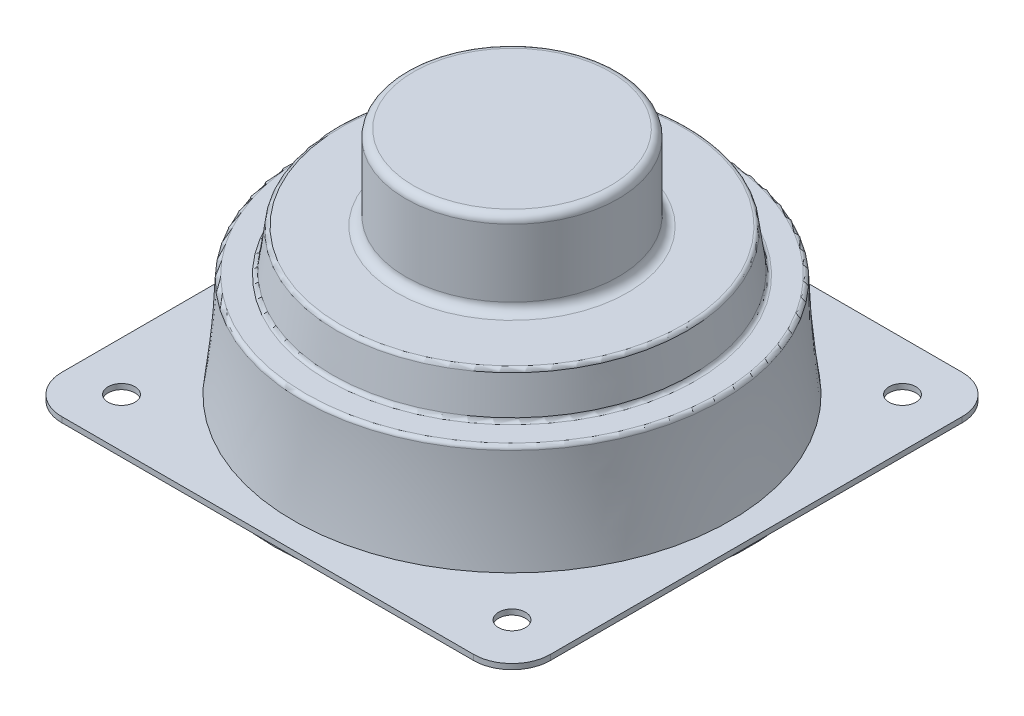
from build123d import *

# Parameters (mm, degrees)
SKETCH1_R           = 1.75
BOSS_EXTRUDE1_DEPTH = 0.7
SKETCH2_R           = 31
BOSS_EXTRUDE2_DEPTH = 1
SKETCH3_R           = 25.2
BOSS_EXTRUDE3_DEPTH = 2
SKETCH6_R           = 23.5
SKETCH7_R           = 22.75
SKETCH8_R           = 13.85
BOSS_EXTRUDE4_DEPTH = 11
FILLET1_R           = 1
FILLET2_R           = 1.2
FILLET3_R           = 0.5


with BuildPart() as part:
    # Sketch1 → Boss-Extrude1 (new body)
    with BuildSketch(Plane(origin=(0, 0, 0), x_dir=(1, 0, 0), z_dir=(0, 1, 0))):
        with BuildLine():
            Line((26.85, -31.85), (-26.85, -31.85))
            ThreePointArc((-26.85, -31.85), (-30.385533906, -30.385533906), (-31.85, -26.85))
            Line((-31.85, -26.85), (-31.85, 26.85))
            ThreePointArc((-31.85, 26.85), (-30.385533906, 30.385533906), (-26.85, 31.85))
            Line((-26.85, 31.85), (26.85, 31.85))
            ThreePointArc((26.85, 31.85), (30.385533906, 30.385533906), (31.85, 26.85))
            Line((31.85, 26.85), (31.85, -26.85))
            ThreePointArc((31.85, -26.85), (30.385533906, -30.385533906), (26.85, -31.85))
        make_face()
        with Locations(Location((-25.455844123, 25.455844123, 0), (0, 0, 270))):
            Circle(SKETCH1_R, mode=Mode.SUBTRACT)
        with Locations(Location((25.455844123, -25.455844123, 0), (0, 0, 270))):
            Circle(SKETCH1_R, mode=Mode.SUBTRACT)
        with Locations(Location((25.455844123, 25.455844123, 0), (0, 0, 270))):
            Circle(SKETCH1_R, mode=Mode.SUBTRACT)
        with Locations(Location((-25.455844123, -25.455844123, 0), (0, 0, 270))):
            Circle(SKETCH1_R, mode=Mode.SUBTRACT)
    extrude(amount=BOSS_EXTRUDE1_DEPTH)

    # Sketch2 → Boss-Extrude2 (add)
    with BuildSketch(Plane.XZ):
        with Locations(Location((0, 0, 0), (0, 0, 270))):
            Circle(SKETCH2_R)
    extrude(amount=BOSS_EXTRUDE2_DEPTH)

    # Sketch3 → Boss-Extrude3 (add)
    with BuildSketch(Plane.XZ.offset(1)):
        with Locations(Location((0, 0, 0), (0, 0, 270))):
            Circle(SKETCH3_R)
    extrude(amount=BOSS_EXTRUDE3_DEPTH)

    # Loft1: read off the stored shape, not the designer's step
    # Loft1: loft between two sections, ruled curve by curve
    loft1_from = [
        Edge.make_bspline([(-9.771875949, 0.7, 26.772382046), (43.772888144, 0.7, 46.316133945), (63.316640042, 0.7, -7.228630148), (9.771875949, 0.7, -26.772382046), (-43.772888144, 0.7, -46.316133945), (-63.316640042, 0.7, 7.228630148), (-9.771875949, 0.7, 26.772382046)], [0, 0, 0, 0, 0.5, 0.5, 0.5, 1, 1, 1, 1], 3, [1, 0.333333333, 0.333333333, 1, 0.333333333, 0.333333333, 1]),
    ]
    loft1_to = [
        Edge.make_bspline([(-3.103696241, 14.2, 27.173324597), (51.242952952, 14.2, 33.380717079), (57.450345435, 14.2, -20.965932114), (3.103696241, 14.2, -27.173324597), (-51.242952952, 14.2, -33.380717079), (-57.450345435, 14.2, 20.965932114), (-3.103696241, 14.2, 27.173324597)], [0, 0, 0, 0, 0.5, 0.5, 0.5, 1, 1, 1, 1], 3, [1, 0.333333333, 0.333333333, 1, 0.333333333, 0.333333333, 1]),
    ]
    loft1 = Solid(Shell([*[Face.make_surface_from_curves(loft1_from[k], loft1_to[k]) for k in range(1)], Face(Wire(loft1_from)), Face(Wire(loft1_to))]))
    add(loft1)

    # Sketch6 → Loft2 section 0
    with BuildSketch(Plane(origin=(0, 14.2, 0), x_dir=(1, 0, 0), z_dir=(0, 1, 0))):
        Circle(SKETCH6_R)
    # Sketch7 → Loft2 section 1
    with BuildSketch(Plane(origin=(0, 19.7, 0), x_dir=(1, 0, 0), z_dir=(0, 1, 0))):
        Circle(SKETCH7_R)
    loft()

    # Sketch8 → Boss-Extrude4 (add)
    with BuildSketch(Plane(origin=(0, 19.7, 0), x_dir=(1, 0, 0), z_dir=(0, 1, 0))):
        with Locations(Location((0, 0, 0), (0, 0, 270))):
            Circle(SKETCH8_R)
    extrude(amount=BOSS_EXTRUDE4_DEPTH)

    # Fillet1
    fillet1_edges = [part.edges().sort_by_distance(p)[0] for p in [
        (0, 30.7, -13.85),
    ]]
    fillet(fillet1_edges, radius=FILLET1_R)

    # Fillet2
    fillet2_edges = [part.edges().sort_by_distance(p)[0] for p in [
        (0, 19.7, -13.85),
    ]]
    fillet(fillet2_edges, radius=FILLET2_R)

    # Fillet3
    fillet3_edges = [part.edges().sort_by_distance(p)[0] for p in [
        (3.103696241, 14.2, -27.173324597),
        (-22.75, 19.7, 0),
        (-23.5, 14.2, 0),
    ]]
    fillet(fillet3_edges, radius=FILLET3_R)


solid = part.part
